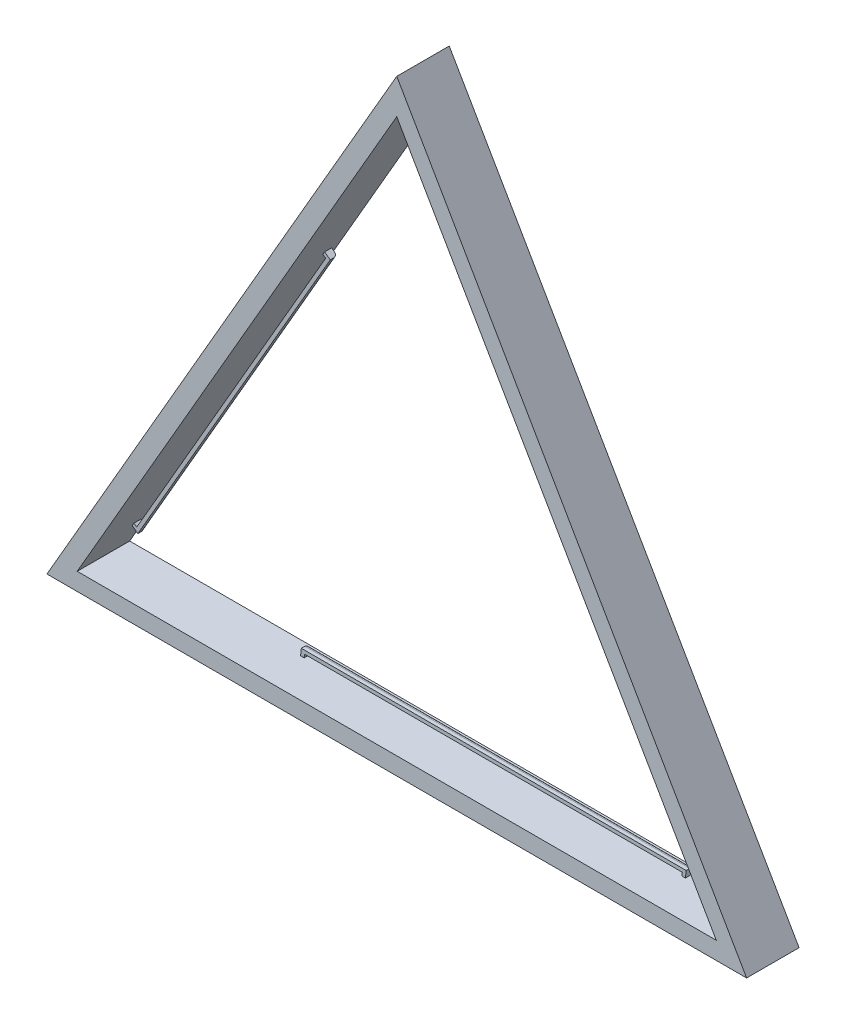
from build123d import *

# Parameters (mm, degrees)
BOSS_EXTRU_1_DEPTH      = 15
BOSS_EXTRU_2_DEPTH      = 2
BOSS_EXTRU_5_DEPTH      = 2
CONG_1_R                = 1
ENL_V_MAT_EXTRU_1_DEPTH = 2


with BuildPart() as part:
    # Esquisse1 → Boss.-Extru.1 (new body)
    with BuildSketch(Plane.XY):
        Polygon((-46.875775887, 92.331472327), (-146.875775887, -80.87360843), (53.124224113, -80.87360843), align=None)
        Polygon((44.463970075, -75.87360843), (-46.875775887, 82.331472327), (-138.21552185, -75.87360843), align=None, mode=Mode.SUBTRACT)
    extrude(amount=BOSS_EXTRU_1_DEPTH)

    # Esquisse2 → Boss.-Extru.2 (add)
    with BuildSketch(Plane(origin=(0, 0, 0), x_dir=(-1, 0, 0), z_dir=(0, 0, -1))):
        Polygon((-53.124224113, -80.87360843), (146.875775887, -80.87360843), (46.875775887, 92.331472327), align=None)
        Polygon((-42.731919267, -74.87360843), (136.483471042, -74.87360843), (46.875775887, 80.331472327), align=None, mode=Mode.SUBTRACT)
    extrude(amount=-BOSS_EXTRU_2_DEPTH)

    # Esquisse3 → Boss.-Extru.5 (add)
    # profile 1 of 3: a face of its own
    with BuildSketch(Plane.XY.offset(2)):
        Polygon((-76.884598102, 26.389185986), (-131.884598102, -68.87360843), (-134.307058992, -67.103952181), (-79.307058992, 28.158842235), align=None)
        Polygon((-78.199650653, 26.111448154), (-78.997792799, 26.694506994), (-132.992006441, -66.826214349), (-132.193864295, -67.409273189), align=None, mode=Mode.SUBTRACT)
    # profile 2 of 3: a face of its own
    with BuildSketch(Plane.XY.offset(2)):
        Polygon((16.217092488, -30.914062884), (18.960890201, -29.700978339), (-36.039109799, 65.561816078), (-38.782907512, 64.348731532), align=None)
        Polygon((16.634090745, -29.636325052), (17.538105586, -29.236643098), (-36.456108056, 64.284078245), (-37.360122897, 63.884396291), align=None, mode=Mode.SUBTRACT)
    # profile 3 of 3: a face of its own
    with BuildSketch(Plane.XY.offset(2)):
        Polygon((-85.155974471, -73.890867636), (-85.477311293, -76.87360843), (24.522688707, -76.87360843), (24.844025529, -73.890867636), align=None)
        Polygon((-84.257920177, -74.890867636), (-84.363792871, -75.87360843), (23.624634413, -75.87360843), (23.730507107, -74.890867636), align=None, mode=Mode.SUBTRACT)
    extrude(amount=BOSS_EXTRU_5_DEPTH)

    # Congé1
    # the kernel refuses this fillet: 1 mm, written as the material it takes off along each edge
    with BuildSketch(Plane(origin=(-40.032907512, 66.513795042, 2), x_dir=(0.8660254037844388, 0.49999999999999967, 0), z_dir=(0.49999999999999967, -0.8660254037844388, 0))) as cong_1_piece_1_section:
        with BuildLine():
            CenterArc((CONG_1_R, CONG_1_R), CONG_1_R, 180, 90)
            Line((0, CONG_1_R), (0, 0))
            Line((0, 0), (CONG_1_R, 0))
        make_face()
    cong_1_piece_1 = extrude(amount=115, mode=Mode.PRIVATE)
    cong_1_piece_1 = split(cong_1_piece_1, bisect_by=Plane(origin=(-10.431829018, 17.208704721, 2.226716308), z_dir=(-0.8660254037844386, -0.5000000000000001, 0)), keep=Keep.TOP, mode=Mode.PRIVATE)
    add(cong_1_piece_1, mode=Mode.SUBTRACT)
    with BuildSketch(Plane(origin=(-75.634598102, 28.554249495, 2), x_dir=(-0.8660254037844388, 0.4999999999999997, 0), z_dir=(-0.4999999999999997, -0.8660254037844388, 0))) as cong_1_piece_2_section:
        with BuildLine():
            CenterArc((CONG_1_R, -CONG_1_R), CONG_1_R, 90, 90)
            Line((0, -CONG_1_R), (0, 0))
            Line((0, 0), (CONG_1_R, 0))
        make_face()
    cong_1_piece_2 = extrude(amount=115, mode=Mode.PRIVATE)
    cong_1_piece_2 = split(cong_1_piece_2, bisect_by=Plane(origin=(-105.235676596, -20.750840825, 2.226716308), z_dir=(0.8660254037844387, -0.5000000000000001, 0)), keep=Keep.TOP, mode=Mode.PRIVATE)
    add(cong_1_piece_2, mode=Mode.SUBTRACT)
    with BuildSketch(Plane(origin=(27.344025529, -73.890867636, 2), x_dir=(0, -1, 0), z_dir=(-1, 0, 0))) as cong_1_piece_3_section:
        with BuildLine():
            CenterArc((CONG_1_R, CONG_1_R), CONG_1_R, 180, 90)
            Line((0, CONG_1_R), (0, 0))
            Line((0, 0), (CONG_1_R, 0))
        make_face()
    cong_1_piece_3 = extrude(amount=115, mode=Mode.PRIVATE)
    cong_1_piece_3 = split(cong_1_piece_3, bisect_by=Plane(origin=(-30.155974471, -74.87360843, 2.226716308), z_dir=(0, 1, 0)), keep=Keep.TOP, mode=Mode.PRIVATE)
    add(cong_1_piece_3, mode=Mode.SUBTRACT)

    # Esquisse3D1 → Enlèv. mat.-Extru.1 (cut)
    with BuildSketch(Plane(origin=(-138.21552185, -75.87360843, 0), x_dir=(1, 0, 0), z_dir=(0, 0, 1))):
        Polygon((0, 0), (182.679491924, 0), (91.339745962, 158.205080757), align=None)
        Polygon((1.732050808, 1), (180.947441117, 1), (91.339745962, 156.205080757), align=None, mode=Mode.SUBTRACT)
    extrude(amount=ENL_V_MAT_EXTRU_1_DEPTH, mode=Mode.SUBTRACT)


solid = part.part
